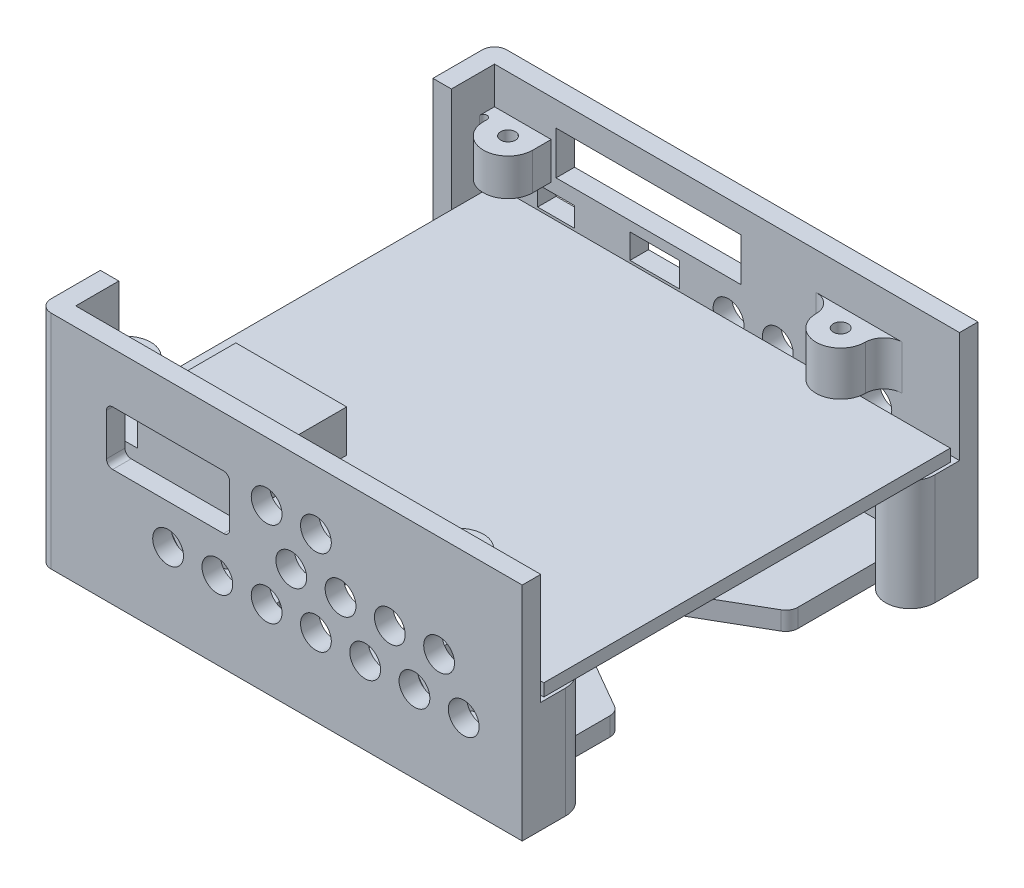
from build123d import *

# Parameters (mm, degrees)
SKETCH1_W                           = 38
SKETCH1_H                           = 33
BOSS_EXTRUDE1_DEPTH                 = 1.5
BOSS_EXTRUDE2_DEPTH                 = 7.5
BOSS_EXTRUDE2_DEPTH_BACK            = 1.5
SKETCH2_R                           = 2
F_1_2_1_2_DIAMETER_HOLE1_D          = 1.2
SKETCH5_W                           = 37
SKETCH5_H                           = 33
BOSS_EXTRUDE3_DEPTH                 = 1
SKETCH6_W                           = 9
SKETCH6_H                           = 8
BOSS_EXTRUDE4_DEPTH                 = 3.4
SKETCH7_W                           = 38
SKETCH7_H                           = 1.5
BOSS_EXTRUDE5_DEPTH                 = 15
BOSS_EXTRUDE6_DEPTH                 = 3
CUT_EXTRUDE1_START                  = -1
CUT_EXTRUDE1_DEPTH                  = 1
SKETCH12_W                          = 38
SKETCH12_H                          = 2
BOSS_EXTRUDE7_DEPTH                 = 1.5
FILLET1_R                           = 1.5
SKETCH11_W                          = 0.6
SKETCH11_H                          = 6
F_1_2_1_2_DIAMETER_HOLE2_AT_2_COUNT = 2
F_1_2_1_2_DIAMETER_HOLE2_AT_2_PITCH = 27
F_1_2_1_2_DIAMETER_HOLE2_AT_3_COUNT = 2
F_1_2_1_2_DIAMETER_HOLE2_AT_3_PITCH = 41.109609582
F_1_2_1_2_DIAMETER_HOLE2_AT_4_COUNT = 2
F_1_2_1_2_DIAMETER_HOLE2_AT_4_PITCH = 31
CUT_EXTRUDE2_START                  = 13
CUT_EXTRUDE2_DEPTH                  = 1
CUT_EXTRUDE2_START_2                = -5
CUT_EXTRUDE2_2_DEPTH                = 5
SKETCH14_W                          = 15
SKETCH14_H                          = 12.618354367
CUT_EXTRUDE3_DEPTH                  = 2.5
SKETCH15_W                          = 4
SKETCH15_H                          = 2
SKETCH15_W_2                        = 3
SKETCH15_H_2                        = 1.6
CUT_EXTRUDE4_DEPTH                  = 1.5
SKETCH20_W                          = 38
SKETCH20_H                          = 1.5
BOSS_EXTRUDE10_DEPTH                = 3
FILL_START                          = -18.5
FILL_PATTERN1_OUTLINE_R             = 1.25
FILL_PATTERN1_DEPTH                 = 1.5
FILL_START_2                        = 17
FILL_PATTERN2_OUTLINE_R             = 1.25
FILL_PATTERN2_DEPTH                 = 1.5
SKETCH16_R                          = 1.05
CUT_EXTRUDE5_DEPTH                  = 1.5
BOSS_EXTRUDE8_DEPTH                 = 1.6
CUT_EXTRUDE6_DEPTH                  = 1.6
SKETCH21_W                          = 15
SKETCH21_H                          = 1.5
CUT_EXTRUDE7_DEPTH                  = 1
SKETCH24_W                          = 1.5
SKETCH24_H                          = 5
BOSS_EXTRUDE11_DEPTH                = 18
SKETCH26_W                          = 4
SKETCH26_H                          = 24
CUT_EXTRUDE9_DEPTH                  = 7
CUT_EXTRUDE10_DEPTH                 = 0.25
CUT_EXTRUDE11_START                 = -7
CUT_EXTRUDE11_DEPTH                 = 7
SKETCH29_R                          = 0.6
CUT_EXTRUDE12_DEPTH                 = 7
FILLET2_START                       = 13
FILLET2_DEPTH                       = 2
FILLET2_START_2                     = 12
FILLET2_2_DEPTH                     = 3
SKETCH30_R                          = 0.6
BOSS_EXTRUDE13_DEPTH                = 0.6
FILLET3_START                       = 1.5
FILLET3_DEPTH                       = 17.5
FILLET3_START_2                     = -1
FILLET3_2_DEPTH                     = 2.651008
FILLET3_3_DEPTH                     = 1.5
FILLET3_START_3                     = 1.34157
FILLET3_4_DEPTH                     = 1.75843


with BuildPart() as part:
    # Sketch1 → Boss-Extrude1 (new body)
    with BuildSketch(Plane(origin=(0, 0, 0), x_dir=(1, 0, 0), z_dir=(0, 1, 0))):
        Rectangle(SKETCH1_W, SKETCH1_H)
    extrude(amount=BOSS_EXTRUDE1_DEPTH)

    # Sketch2 → Boss-Extrude2 (add, two sides: drawn at the far end of the back side and taken through both)
    with BuildSketch(Plane(origin=(0, 1.5, 0), x_dir=(1, 0, 0), z_dir=(0, 1, 0)).offset(-BOSS_EXTRUDE2_DEPTH_BACK)):
        with Locations(Location((-16.75, 9.75, 0), (0, 0, 270))):
            Circle(SKETCH2_R)
        with Locations(Location((-16.75, -9.75, 0), (0, 0, 270))):
            Circle(SKETCH2_R)
        with BuildLine():
            Line((16.75, 17), (18.75, 17))
            Line((18.75, 17), (18.75, 15))
            ThreePointArc((18.75, 15), (15.335786438, 13.585786438), (16.75, 17))
        make_face()
        with BuildLine():
            Line((16.75, -17), (18.75, -17))
            Line((18.75, -17), (18.75, -15))
            ThreePointArc((18.75, -15), (15.335786438, -13.585786438), (16.75, -17))
        make_face()
    extrude(amount=BOSS_EXTRUDE2_DEPTH + BOSS_EXTRUDE2_DEPTH_BACK)

    # Ø1.2 (1.2) Diameter Hole1 (through all)
    with Locations(Plane(origin=(0, 9, 0), x_dir=(1, 0, 0), z_dir=(0, 1, 0))):
        with Locations((-16.75, 9.75), (-16.75, -9.75), (16.75, -15), (16.75, 15)):
            Hole(F_1_2_1_2_DIAMETER_HOLE1_D / 2)

    # Sketch7 → Boss-Extrude5 (add)
    with BuildSketch(Plane(origin=(0, 0, 0), x_dir=(1, 0, 0), z_dir=(0, 1, 0))):
        with Locations((0, 17.75)):
            Rectangle(SKETCH7_W, SKETCH7_H)
        with Locations((0, -17.75)):
            Rectangle(SKETCH7_W, SKETCH7_H)
    extrude(amount=BOSS_EXTRUDE5_DEPTH)

    # Sketch8 → Boss-Extrude6 (add)
    with BuildSketch(Plane(origin=(0, 15, 0), x_dir=(1, 0, 0), z_dir=(0, 1, 0))):
        with BuildLine():
            Line((12.6, 15.5), (12.6, 18.5))
            Line((12.6, 18.5), (8.6, 18.5))
            Line((8.6, 18.5), (8.6, 15.5))
            ThreePointArc((8.6, 15.5), (10.6, 13.5), (12.6, 15.5))
        make_face()
        with BuildLine():
            Line((-18.4, 15.5), (-18.4, 18.5))
            Line((-18.4, 18.5), (-14.4, 18.5))
            Line((-14.4, 18.5), (-14.4, 15.5))
            ThreePointArc((-14.4, 15.5), (-16.4, 13.5), (-18.4, 15.5))
        make_face()
        with BuildLine():
            Line((-18.4, -15.5), (-18.4, -18.5))
            Line((-18.4, -18.5), (-14.4, -18.5))
            Line((-14.4, -18.5), (-14.4, -15.5))
            ThreePointArc((-14.4, -15.5), (-16.4, -13.5), (-18.4, -15.5))
        make_face()
        with BuildLine():
            Line((8.6, -15.5), (8.6, -18.5))
            Line((8.6, -18.5), (12.6, -18.5))
            Line((12.6, -18.5), (12.6, -15.5))
            ThreePointArc((12.6, -15.5), (10.6, -13.5), (8.6, -15.5))
        make_face()
    extrude(amount=-BOSS_EXTRUDE6_DEPTH)

    # Sketch9 → Cut-Extrude1 (cut)
    with BuildSketch(Plane.XZ.offset(-12).offset(CUT_EXTRUDE1_START)):
        with BuildLine():
            Line((-14.4, 15.5), (-14.4, 17))
            Line((-14.4, 17), (-18.4, 17))
            Line((-18.4, 17), (-18.4, 15.5))
            ThreePointArc((-18.4, 15.5), (-16.4, 13.5), (-14.4, 15.5))
        make_face()
    extrude(amount=CUT_EXTRUDE1_DEPTH, mode=Mode.SUBTRACT)

    # Sketch12 → Boss-Extrude7 (add)
    with BuildSketch(Plane.XZ):
        with Locations((0, -17.5)):
            Rectangle(SKETCH12_W, SKETCH12_H)
        with Locations((0, 17.5)):
            Rectangle(SKETCH12_W, SKETCH12_H)
    extrude(amount=-BOSS_EXTRUDE7_DEPTH)

    # Fillet1
    # the kernel refuses this fillet: 1.5 mm, written as the material it adds along each edge
    with BuildSketch(Plane(origin=(12.6, 12, 17), x_dir=(1, 0, 0), z_dir=(0, 1, 0)), Plane(origin=(8.6, 15, 17), x_dir=(-1, 0, 0), z_dir=(0, -1, 0))) as fillet1_piece_1:
        with BuildLine():
            CenterArc((FILLET1_R, FILLET1_R), FILLET1_R, 180, 90)
            Line((0, FILLET1_R), (-FILLET1_R * 0.02, FILLET1_R))
            Line((-FILLET1_R * 0.02, FILLET1_R), (-FILLET1_R * 0.02, -FILLET1_R * 0.02))
            Line((-FILLET1_R * 0.02, -FILLET1_R * 0.02), (FILLET1_R, -FILLET1_R * 0.02))
            Line((FILLET1_R, -FILLET1_R * 0.02), (FILLET1_R, 0))
        make_face()
    extrude(amount=3)
    with BuildSketch(Plane(origin=(8.6, 15, -17), x_dir=(-1, 0, 0), z_dir=(0, -1, 0)), Plane(origin=(12.6, 12, -17), x_dir=(1, 0, 0), z_dir=(0, 1, 0))) as fillet1_piece_2:
        with BuildLine():
            CenterArc((FILLET1_R, -FILLET1_R), FILLET1_R, 90, 90)
            Line((0, -FILLET1_R), (-FILLET1_R * 0.02, -FILLET1_R))
            Line((-FILLET1_R * 0.02, -FILLET1_R), (-FILLET1_R * 0.02, FILLET1_R * 0.02))
            Line((-FILLET1_R * 0.02, FILLET1_R * 0.02), (FILLET1_R, FILLET1_R * 0.02))
            Line((FILLET1_R, FILLET1_R * 0.02), (FILLET1_R, 0))
        make_face()
    extrude(amount=3)
    with BuildSketch(Plane(origin=(-18.4, 12, -17), x_dir=(-1, 0, 0), z_dir=(0, 1, 0))) as fillet1_piece_3:
        with BuildLine():
            CenterArc((1.5, 1.2), FILLET1_R, 180, 53.130102354)
            Line((0, 1.2), (-0.03, 1.2))
            Line((-0.03, 1.2), (-0.03, 0))
            Line((-0.03, 0), (0, -0.03))
            ThreePointArc((0, -0.03), (0.3, -0.03), (0.582, -0.024))
            Line((0.582, -0.024), (0.6, 0))
        make_face()
    extrude(amount=3)
    with BuildSketch(Plane(origin=(-14.4, 13, 17), x_dir=(1, 0, 0), z_dir=(0, 1, 0))) as fillet1_piece_4:
        with BuildLine():
            CenterArc((FILLET1_R, FILLET1_R), FILLET1_R, 180, 90)
            Line((0, FILLET1_R), (-FILLET1_R * 0.02, FILLET1_R))
            Line((-FILLET1_R * 0.02, FILLET1_R), (-FILLET1_R * 0.02, -FILLET1_R * 0.02))
            Line((-FILLET1_R * 0.02, -FILLET1_R * 0.02), (FILLET1_R, -FILLET1_R * 0.02))
            Line((FILLET1_R, -FILLET1_R * 0.02), (FILLET1_R, 0))
        make_face()
    extrude(amount=2)
    with BuildSketch(Plane(origin=(-18.4, 15, 17), x_dir=(-1, 0, 0), z_dir=(0, -1, 0))) as fillet1_piece_5:
        with BuildLine():
            CenterArc((1.5, 1.2), FILLET1_R, 180, 53.130102354)
            Line((0, 1.2), (-0.03, 1.2))
            Line((-0.03, 1.2), (-0.03, 0))
            Line((-0.03, 0), (0, -0.03))
            ThreePointArc((0, -0.03), (0.3, -0.03), (0.582, -0.024))
            Line((0.582, -0.024), (0.6, 0))
        make_face()
    extrude(amount=2)

    # Sketch11 → Ø1.2 (1.2) Diameter Hole2 (revolve, cut)
    with BuildSketch(Plane(origin=(-16.4, 15, 15.5), x_dir=(0, 0, 1), z_dir=(1, 0, 0))):
        with Locations((0.3, 3)):
            Rectangle(SKETCH11_W, SKETCH11_H)
    f_1_2_1_2_diameter_hole2 = revolve(axis=Axis((-16.4, 21.35, 15.5), (0, -1, 0)), mode=Mode.SUBTRACT)

    # Ø1.2 (1.2) Diameter Hole2 at 2: Ø1.2 (1.2) Diameter Hole2 ×2
    with Locations(*[(i * F_1_2_1_2_DIAMETER_HOLE2_AT_2_PITCH, 0, 0) for i in range(1, F_1_2_1_2_DIAMETER_HOLE2_AT_2_COUNT)]):
        add(f_1_2_1_2_diameter_hole2, mode=Mode.SUBTRACT)

    # Ø1.2 (1.2) Diameter Hole2 at 3: Ø1.2 (1.2) Diameter Hole2 ×2
    with Locations(*[Vector(0.6567807448042019, 0, -0.7540815958863059) * (i * F_1_2_1_2_DIAMETER_HOLE2_AT_3_PITCH) for i in range(1, F_1_2_1_2_DIAMETER_HOLE2_AT_3_COUNT)]):
        add(f_1_2_1_2_diameter_hole2, mode=Mode.SUBTRACT)

    # Ø1.2 (1.2) Diameter Hole2 at 4: Ø1.2 (1.2) Diameter Hole2 ×2
    with Locations(*[(0, 0, -i * F_1_2_1_2_DIAMETER_HOLE2_AT_4_PITCH) for i in range(1, F_1_2_1_2_DIAMETER_HOLE2_AT_4_COUNT)]):
        add(f_1_2_1_2_diameter_hole2, mode=Mode.SUBTRACT)

    # Cut-Extrude2 2 outline → Cut-Extrude2 2 (cut)
    with BuildSketch(Plane.XY.offset(18.5).offset(CUT_EXTRUDE2_START_2)):
        with BuildLine():
            ThreePointArc((-5, 13.4), (-5.146446609, 13.753553391), (-5.5, 13.9))
            Line((-5.5, 13.9), (-14.5, 13.9))
            ThreePointArc((-14.5, 13.9), (-14.853553391, 13.753553391), (-15, 13.4))
            Line((-15, 13.4), (-15, 13))
            Line((-15, 13), (-15, 10))
            ThreePointArc((-15, 10), (-14.853553391, 9.646446609), (-14.5, 9.5))
            Line((-14.5, 9.5), (-5.5, 9.5))
            ThreePointArc((-5.5, 9.5), (-5.146446609, 9.646446609), (-5, 10))
            Line((-5, 10), (-5, 13.4))
        make_face()
    extrude(amount=CUT_EXTRUDE2_2_DEPTH, mode=Mode.SUBTRACT)

    # Sketch14 → Cut-Extrude3 (cut)
    with BuildSketch(Plane(origin=(0, 15, 0), x_dir=(1, 0, 0), z_dir=(0, 1, 0))):
        with Locations((-6.5, 16.147378524)):
            Rectangle(SKETCH14_W, SKETCH14_H)
    extrude(amount=-CUT_EXTRUDE3_DEPTH, mode=Mode.SUBTRACT)

    # Sketch15 → Cut-Extrude4 (cut)
    with BuildSketch(Plane(origin=(0, 0, -18.5), x_dir=(-1, 0, 0), z_dir=(0, 0, -1))):
        with Locations((6, 10.7)):
            Rectangle(SKETCH15_W, SKETCH15_H)
        with Locations((14, 10.5)):
            Rectangle(SKETCH15_W_2, SKETCH15_H_2)
    extrude(amount=-CUT_EXTRUDE4_DEPTH, mode=Mode.SUBTRACT)

    # Sketch20 → Boss-Extrude10 (add)
    with BuildSketch(Plane(origin=(0, 15, 0), x_dir=(1, 0, 0), z_dir=(0, 1, 0))):
        with Locations((0, -17.75)):
            Rectangle(SKETCH20_W, SKETCH20_H)
        with Locations((0, 17.75)):
            Rectangle(SKETCH20_W, SKETCH20_H)
    extrude(amount=BOSS_EXTRUDE10_DEPTH)

    # Fill Pattern1: read off the stored shape, not the designer's step
    # Fill Pattern1 outline → Fill Pattern1 (cut)
    with BuildSketch(Plane.XY.offset(FILL_START)):
        with Locations((14, 6.285898385)):
            Circle(FILL_PATTERN1_OUTLINE_R)
        with Locations((-2, 6.285898385)):
            Circle(FILL_PATTERN1_OUTLINE_R)
        with Locations((2, 6.285898385)):
            Circle(FILL_PATTERN1_OUTLINE_R)
        with Locations((6, 6.285898385)):
            Circle(FILL_PATTERN1_OUTLINE_R)
        with Locations((-6, 6.285898385)):
            Circle(FILL_PATTERN1_OUTLINE_R)
        with Locations((-10, 6.285898385)):
            Circle(FILL_PATTERN1_OUTLINE_R)
        with Locations((-14, 6.285898385)):
            Circle(FILL_PATTERN1_OUTLINE_R)
        with Locations((10, 6.285898385)):
            Circle(FILL_PATTERN1_OUTLINE_R)
        with Locations((0, 9.75)):
            Circle(FILL_PATTERN1_OUTLINE_R)
        with Locations((4, 9.75)):
            Circle(FILL_PATTERN1_OUTLINE_R)
        with Locations((8, 9.75)):
            Circle(FILL_PATTERN1_OUTLINE_R)
        with Locations((12, 9.75)):
            Circle(FILL_PATTERN1_OUTLINE_R)
    extrude(amount=FILL_PATTERN1_DEPTH, mode=Mode.SUBTRACT)

    # Fill Pattern2: read off the stored shape, not the designer's step
    # Fill Pattern2 outline → Fill Pattern2 (cut)
    with BuildSketch(Plane.XY.offset(FILL_START_2)):
        with Locations((14, 6.285898385)):
            Circle(FILL_PATTERN2_OUTLINE_R)
        with Locations((-2, 6.285898385)):
            Circle(FILL_PATTERN2_OUTLINE_R)
        with Locations((2, 6.285898385)):
            Circle(FILL_PATTERN2_OUTLINE_R)
        with Locations((6, 6.285898385)):
            Circle(FILL_PATTERN2_OUTLINE_R)
        with Locations((-6, 6.285898385)):
            Circle(FILL_PATTERN2_OUTLINE_R)
        with Locations((-10, 6.285898385)):
            Circle(FILL_PATTERN2_OUTLINE_R)
        with Locations((10, 6.285898385)):
            Circle(FILL_PATTERN2_OUTLINE_R)
        with Locations((0, 9.75)):
            Circle(FILL_PATTERN2_OUTLINE_R)
        with Locations((4, 9.75)):
            Circle(FILL_PATTERN2_OUTLINE_R)
        with Locations((8, 9.75)):
            Circle(FILL_PATTERN2_OUTLINE_R)
        with Locations((12, 9.75)):
            Circle(FILL_PATTERN2_OUTLINE_R)
        with Locations((2, 13.214101615)):
            Circle(FILL_PATTERN2_OUTLINE_R)
        with Locations((-2, 13.214101615)):
            Circle(FILL_PATTERN2_OUTLINE_R)
    extrude(amount=FILL_PATTERN2_DEPTH, mode=Mode.SUBTRACT)

    # Sketch16 → Cut-Extrude5 (cut)
    with BuildSketch(Plane.XZ):
        with Locations(Location((7, 10, 0), (0, 0, 270))):
            Circle(SKETCH16_R)
        with Locations(Location((7, -10, 0), (0, 0, 270))):
            Circle(SKETCH16_R)
        with Locations(Location((-13, -10, 0), (0, 0, 270))):
            Circle(SKETCH16_R)
        with Locations(Location((-13, 10, 0), (0, 0, 270))):
            Circle(SKETCH16_R)
    extrude(amount=-CUT_EXTRUDE5_DEPTH, mode=Mode.SUBTRACT)

    # Sketch17 → Boss-Extrude8 (add)
    # profile 1 of 4: a face of its own
    with BuildSketch(Plane(origin=(0, 1.5, 0), x_dir=(1, 0, 0), z_dir=(0, 1, 0))):
        Polygon((10.55, 7.950406544), (10.55, 12.049593456), (7, 14.099186911), (3.45, 12.049593456), (3.45, 7.950406544), (7, 5.900813089), align=None)
        Polygon((9.05, 8.816431948), (9.05, 11.183568052), (7, 12.367136104), (4.95, 11.183568052), (4.95, 8.816431948), (7, 7.632863896), align=None, mode=Mode.SUBTRACT)
    # profile 2 of 4: a face of its own
    with BuildSketch(Plane(origin=(0, 1.5, 0), x_dir=(1, 0, 0), z_dir=(0, 1, 0))):
        Polygon((10.55, -7.950406544), (7, -5.900813089), (3.45, -7.950406544), (3.45, -12.049593456), (7, -14.099186911), (10.55, -12.049593456), align=None)
        Polygon((9.05, -8.816431948), (7, -7.632863896), (4.95, -8.816431948), (4.95, -11.183568052), (7, -12.367136104), (9.05, -11.183568052), align=None, mode=Mode.SUBTRACT)
    # profile 3 of 4: a face of its own
    with BuildSketch(Plane(origin=(0, 1.5, 0), x_dir=(1, 0, 0), z_dir=(0, 1, 0))):
        Polygon((-9.45, -7.950406544), (-13, -5.900813089), (-16.55, -7.950406544), (-16.55, -12.049593456), (-13, -14.099186911), (-9.45, -12.049593456), align=None)
        Polygon((-10.95, -8.816431948), (-13, -7.632863896), (-15.05, -8.816431948), (-15.05, -11.183568052), (-13, -12.367136104), (-10.95, -11.183568052), align=None, mode=Mode.SUBTRACT)
    # profile 4 of 4: a face of its own
    with BuildSketch(Plane(origin=(0, 1.5, 0), x_dir=(1, 0, 0), z_dir=(0, 1, 0))):
        Polygon((-13, 5.900813089), (-9.45, 7.950406544), (-9.45, 12.049593456), (-13, 14.099186911), (-16.55, 12.049593456), (-16.55, 7.950406544), align=None)
        Polygon((-13, 7.632863896), (-10.95, 8.816431948), (-10.95, 11.183568052), (-13, 12.367136104), (-15.05, 11.183568052), (-15.05, 8.816431948), align=None, mode=Mode.SUBTRACT)
    extrude(amount=BOSS_EXTRUDE8_DEPTH)

    # Sketch18 → Cut-Extrude6 (cut)
    with BuildSketch(Plane(origin=(0, 1.5, 0), x_dir=(1, 0, 0), z_dir=(0, 1, 0))):
        Polygon((0.45, -6.218355737), (7, -2.436711474), (15, -7.055513627), (15, 7.055513627), (7, 2.436711474), (0.45, 6.218355737), (0.45, 14), (-6.45, 14), (-6.45, 6.218355737), (-13, 2.436711474), (-17.5, 5.034787685), (-17.5, -5.034787685), (-13, -2.436711474), (-6.45, -6.218355737), (-6.45, -14), (0.45, -14), align=None)
    extrude(amount=-CUT_EXTRUDE6_DEPTH, mode=Mode.SUBTRACT)

    # Sketch21 → Cut-Extrude7 (cut)
    with BuildSketch(Plane.XZ.offset(-15)):
        with Locations((-6.5, -17.75)):
            Rectangle(SKETCH21_W, SKETCH21_H)
    extrude(amount=-CUT_EXTRUDE7_DEPTH, mode=Mode.SUBTRACT)

    # Sketch24 → Boss-Extrude11 (add)
    with BuildSketch(Plane.XZ):
        with Locations((-19.75, -16)):
            Rectangle(SKETCH24_W, SKETCH24_H)
        with Locations((-19.75, 16)):
            Rectangle(SKETCH24_W, SKETCH24_H)
    extrude(amount=-BOSS_EXTRUDE11_DEPTH)

    # Sketch26 → Cut-Extrude9 (cut)
    with BuildSketch(Plane(origin=(0, 1.5, 0), x_dir=(1, 0, 0), z_dir=(0, 1, 0))):
        with Locations((17, 0)):
            Rectangle(SKETCH26_W, SKETCH26_H)
    extrude(amount=-CUT_EXTRUDE9_DEPTH, mode=Mode.SUBTRACT)

    # Sketch27 → Cut-Extrude10 (cut)
    with BuildSketch(Plane(origin=(19, 0, 0), x_dir=(0, 0, -1), z_dir=(1, 0, 0))):
        Polygon((-12, 0), (-12, 1.5), (-17, 1.5), (-17, 18), (-18.5, 18), (-18.5, 0), align=None)
        Polygon((12, 1.5), (12, 0), (18.5, 0), (18.5, 18), (17, 18), (17, 1.5), align=None)
    extrude(amount=-CUT_EXTRUDE10_DEPTH, mode=Mode.SUBTRACT)

    # Sketch28 → Cut-Extrude11 (cut)
    with BuildSketch(Plane(origin=(0, 1.5, 0), x_dir=(1, 0, 0), z_dir=(0, 1, 0)).offset(CUT_EXTRUDE11_START)):
        with BuildLine():
            Line((18.75, -15), (18.75, -12))
            Line((18.75, -12), (15, -12))
            Line((15, -12), (15, -14.031754163))
            ThreePointArc((15, -14.031754163), (17.25, -13.063508327), (18.75, -15))
        make_face()
        with BuildLine():
            Line((18.75, 15), (18.75, 12))
            Line((18.75, 12), (15, 12))
            Line((15, 12), (15, 14.031754163))
            ThreePointArc((15, 14.031754163), (17.25, 13.063508327), (18.75, 15))
        make_face()
    extrude(amount=CUT_EXTRUDE11_DEPTH, mode=Mode.SUBTRACT)

    # Sketch29 → Cut-Extrude12 (cut)
    with BuildSketch(Plane(origin=(0, 1.5, 0), x_dir=(1, 0, 0), z_dir=(0, 1, 0))):
        with Locations(Location((-16.75, -9.75, 0), (0, 0, 270))):
            Circle(SKETCH29_R)
        with Locations(Location((-16.75, 9.75, 0), (0, 0, 270))):
            Circle(SKETCH29_R)
        Polygon((-15.05, -11.183568052), (-15.05, -8.816431948), (-13, -7.632863896), (-10.95, -8.816431948), (-10.95, -11.183568052), (-13, -12.367136104), align=None)
        Polygon((-15.05, 11.183568052), (-15.05, 8.816431948), (-14.997569049, 8.786160925), (-13, 7.632863896), (-10.95, 8.816431948), (-10.95, 11.183568052), (-13, 12.367136104), align=None)
    extrude(amount=CUT_EXTRUDE12_DEPTH, mode=Mode.SUBTRACT)

    # Fillet2: read off the stored shape, not the designer's step
    # Fillet2 outline → Fillet2 (add)
    with BuildSketch(Plane(origin=(0, 0, 0), x_dir=(1, 0, 0), z_dir=(0, 1, 0)).offset(FILLET2_START)):
        with BuildLine():
            ThreePointArc((-18.4, -15.8), (-18.7, -16.1), (-19, -15.8))
            Line((-19, -15.8), (-19, -17))
            ThreePointArc((-19, -17), (-18.558359214, -16.470820393), (-18.4, -15.8))
        make_face()
        with BuildLine():
            Line((-19, 17), (-19, 15.8))
            ThreePointArc((-19, 15.8), (-18.7, 16.1), (-18.4, 15.8))
            ThreePointArc((-18.4, 15.8), (-18.558359214, 16.470820393), (-19, 17))
        make_face()
    extrude(amount=FILLET2_DEPTH)

    # Fillet2 2 outline → Fillet2 2 (add)
    with BuildSketch(Plane(origin=(0, 0, 0), x_dir=(1, 0, 0), z_dir=(0, 1, 0)).offset(FILLET2_START_2)):
        with BuildLine():
            Line((-19, 17), (-19, 15.8))
            ThreePointArc((-19, 15.8), (-18.7, 16.1), (-18.4, 15.8))
            ThreePointArc((-18.4, 15.8), (-18.558359214, 16.470820393), (-19, 17))
        make_face()
    extrude(amount=FILLET2_2_DEPTH)

    # Sketch30 → Boss-Extrude13 (add)
    with BuildSketch(Plane.XZ.offset(-12)):
        with BuildLine():
            Line((7.1, -17), (14.1, -17))
            ThreePointArc((14.1, -17), (13.039339828, -16.560660172), (12.6, -15.5))
            ThreePointArc((12.6, -15.5), (10.6, -13.5), (8.6, -15.5))
            ThreePointArc((8.6, -15.5), (8.160660172, -16.560660172), (7.1, -17))
        make_face()
        with Locations(Location((10.6, -15.5, 0), (0, 0, 90))):
            Circle(SKETCH30_R, mode=Mode.SUBTRACT)
    extrude(amount=BOSS_EXTRUDE13_DEPTH)

    # Fillet3: read off the stored shape, not the designer's step
    # Fillet3 outline → Fillet3 (cut)
    with BuildSketch(Plane(origin=(0, 0, 0), x_dir=(1, 0, 0), z_dir=(0, 1, 0)).offset(FILLET3_START)):
        with BuildLine():
            ThreePointArc((-19.5, -18.5), (-20.207106781, -18.207106781), (-20.5, -17.5))
            Line((-20.5, -17.5), (-20.5, -18.5))
            Line((-20.5, -18.5), (-19.5, -18.5))
        make_face()
        with BuildLine():
            ThreePointArc((-20.5, 17.5), (-20.207106781, 18.207106781), (-19.5, 18.5))
            Line((-19.5, 18.5), (-20.5, 18.5))
            Line((-20.5, 18.5), (-20.5, 17.5))
        make_face()
        with BuildLine():
            Line((-13, -5.900813089), (-13.5, -6.189488223))
            ThreePointArc((-13.5, -6.189488223), (-13, -6.055513627), (-12.5, -6.189488223))
            Line((-12.5, -6.189488223), (-13, -5.900813089))
        make_face()
        with BuildLine():
            ThreePointArc((-12.5, -13.810511777), (-13, -13.944486373), (-13.5, -13.810511777))
            Line((-13.5, -13.810511777), (-13, -14.099186911))
            Line((-13, -14.099186911), (-12.5, -13.810511777))
        make_face()
        with BuildLine():
            Line((-9.45, -7.950406544), (-9.95, -7.66173141))
            ThreePointArc((-9.95, -7.66173141), (-9.583974596, -8.027756814), (-9.45, -8.527756814))
            Line((-9.45, -8.527756814), (-9.45, -7.950406544))
        make_face()
        with BuildLine():
            ThreePointArc((-9.45, -11.472243186), (-9.583974596, -11.972243186), (-9.95, -12.33826859))
            Line((-9.95, -12.33826859), (-9.45, -12.049593456))
            Line((-9.45, -12.049593456), (-9.45, -11.472243186))
        make_face()
        with BuildLine():
            Line((-9.45, 12.049593456), (-9.95, 12.33826859))
            ThreePointArc((-9.95, 12.33826859), (-9.583974596, 11.972243186), (-9.45, 11.472243186))
            Line((-9.45, 11.472243186), (-9.45, 12.049593456))
        make_face()
        with BuildLine():
            ThreePointArc((-13.5, 13.810511777), (-13, 13.944486373), (-12.5, 13.810511777))
            Line((-12.5, 13.810511777), (-13, 14.099186911))
            Line((-13, 14.099186911), (-13.5, 13.810511777))
        make_face()
        with BuildLine():
            Line((-9.45, 7.950406544), (-9.45, 8.527756814))
            ThreePointArc((-9.45, 8.527756814), (-9.583974596, 8.027756814), (-9.95, 7.66173141))
            Line((-9.95, 7.66173141), (-9.45, 7.950406544))
        make_face()
        with BuildLine():
            Line((-13, 5.900813089), (-12.5, 6.189488223))
            ThreePointArc((-12.5, 6.189488223), (-13, 6.055513627), (-13.5, 6.189488223))
            Line((-13.5, 6.189488223), (-13, 5.900813089))
        make_face()
        with BuildLine():
            Line((10.55, -12.049593456), (10.55, -11.472243186))
            ThreePointArc((10.55, -11.472243186), (10.416025404, -11.972243186), (10.05, -12.33826859))
            Line((10.05, -12.33826859), (10.55, -12.049593456))
        make_face()
        with BuildLine():
            ThreePointArc((10.05, -7.66173141), (10.416025404, -8.027756814), (10.55, -8.527756814))
            Line((10.55, -8.527756814), (10.55, -7.950406544))
            Line((10.55, -7.950406544), (10.05, -7.66173141))
        make_face()
        with BuildLine():
            Line((7, -14.099186911), (7.5, -13.810511777))
            ThreePointArc((7.5, -13.810511777), (7, -13.944486373), (6.5, -13.810511777))
            Line((6.5, -13.810511777), (7, -14.099186911))
        make_face()
        with BuildLine():
            ThreePointArc((6.5, -6.189488223), (7, -6.055513627), (7.5, -6.189488223))
            Line((7.5, -6.189488223), (7, -5.900813089))
            Line((7, -5.900813089), (6.5, -6.189488223))
        make_face()
        with BuildLine():
            Line((3.45, -12.049593456), (3.95, -12.33826859))
            ThreePointArc((3.95, -12.33826859), (3.583974596, -11.972243186), (3.45, -11.472243186))
            Line((3.45, -11.472243186), (3.45, -12.049593456))
        make_face()
        with BuildLine():
            ThreePointArc((3.45, -8.527756814), (3.583974596, -8.027756814), (3.95, -7.66173141))
            Line((3.95, -7.66173141), (3.45, -7.950406544))
            Line((3.45, -7.950406544), (3.45, -8.527756814))
        make_face()
        with BuildLine():
            Line((7, 5.900813089), (7.5, 6.189488223))
            ThreePointArc((7.5, 6.189488223), (7, 6.055513627), (6.5, 6.189488223))
            Line((6.5, 6.189488223), (7, 5.900813089))
        make_face()
        with BuildLine():
            ThreePointArc((10.55, 8.527756814), (10.416025404, 8.027756814), (10.05, 7.66173141))
            Line((10.05, 7.66173141), (10.55, 7.950406544))
            Line((10.55, 7.950406544), (10.55, 8.527756814))
        make_face()
        with BuildLine():
            Line((3.45, 7.950406544), (3.95, 7.66173141))
            ThreePointArc((3.95, 7.66173141), (3.583974596, 8.027756814), (3.45, 8.527756814))
            Line((3.45, 8.527756814), (3.45, 7.950406544))
        make_face()
        with BuildLine():
            ThreePointArc((10.05, 12.33826859), (10.416025404, 11.972243186), (10.55, 11.472243186))
            Line((10.55, 11.472243186), (10.55, 12.049593456))
            Line((10.55, 12.049593456), (10.05, 12.33826859))
        make_face()
        with BuildLine():
            Line((3.45, 12.049593456), (3.45, 11.472243186))
            ThreePointArc((3.45, 11.472243186), (3.583974596, 11.972243186), (3.95, 12.33826859))
            Line((3.95, 12.33826859), (3.45, 12.049593456))
        make_face()
        with BuildLine():
            ThreePointArc((6.5, 13.810511777), (7, 13.944486373), (7.5, 13.810511777))
            Line((7.5, 13.810511777), (7, 14.099186911))
            Line((7, 14.099186911), (6.5, 13.810511777))
        make_face()
    extrude(amount=FILLET3_DEPTH, mode=Mode.SUBTRACT)

    # Fillet3 2 outline → Fillet3 2 (cut)
    with BuildSketch(Plane(origin=(0, 0, 0), x_dir=(1, 0, 0), z_dir=(0, 1, 0)).offset(FILLET3_START_2)):
        with BuildLine():
            ThreePointArc((-19.5, -18.5), (-20.207106781, -18.207106781), (-20.5, -17.5))
            Line((-20.5, -17.5), (-20.5, -18.5))
            Line((-20.5, -18.5), (-19.5, -18.5))
        make_face()
        with BuildLine():
            ThreePointArc((-20.5, 17.5), (-20.207106781, 18.207106781), (-19.5, 18.5))
            Line((-19.5, 18.5), (-20.5, 18.5))
            Line((-20.5, 18.5), (-20.5, 17.5))
        make_face()
        with BuildLine():
            Line((15, -7.055513627), (14.5, -6.766838493))
            ThreePointArc((14.5, -6.766838493), (14.866025404, -7.132863896), (15, -7.632863896))
            Line((15, -7.632863896), (15, -7.055513627))
        make_face()
        with BuildLine():
            Line((7, -2.436711474), (6.5, -2.725386608))
            ThreePointArc((6.5, -2.725386608), (7, -2.591412012), (7.5, -2.725386608))
            Line((7.5, -2.725386608), (7, -2.436711474))
        make_face()
        with BuildLine():
            Line((0.45, -6.218355737), (0.45, -6.795706006))
            ThreePointArc((0.45, -6.795706006), (0.583974596, -6.295706006), (0.95, -5.929680602))
            Line((0.95, -5.929680602), (0.45, -6.218355737))
        make_face()
        with BuildLine():
            Line((-6.45, -6.218355737), (-6.95, -5.929680602))
            ThreePointArc((-6.95, -5.929680602), (-6.583974596, -6.295706006), (-6.45, -6.795706006))
            Line((-6.45, -6.795706006), (-6.45, -6.218355737))
        make_face()
        with BuildLine():
            Line((-13, -2.436711474), (-13.5, -2.725386608))
            ThreePointArc((-13.5, -2.725386608), (-13, -2.591412012), (-12.5, -2.725386608))
            Line((-12.5, -2.725386608), (-13, -2.436711474))
        make_face()
        with BuildLine():
            Line((-13, 2.436711474), (-12.5, 2.725386608))
            ThreePointArc((-12.5, 2.725386608), (-13, 2.591412012), (-13.5, 2.725386608))
            Line((-13.5, 2.725386608), (-13, 2.436711474))
        make_face()
        with BuildLine():
            Line((-6.45, 6.218355737), (-6.45, 6.795706006))
            ThreePointArc((-6.45, 6.795706006), (-6.583974596, 6.295706006), (-6.95, 5.929680602))
            Line((-6.95, 5.929680602), (-6.45, 6.218355737))
        make_face()
        with BuildLine():
            Line((0.45, 6.218355737), (0.95, 5.929680602))
            ThreePointArc((0.95, 5.929680602), (0.583974596, 6.295706006), (0.45, 6.795706006))
            Line((0.45, 6.795706006), (0.45, 6.218355737))
        make_face()
        with BuildLine():
            Line((7, 2.436711474), (7.5, 2.725386608))
            ThreePointArc((7.5, 2.725386608), (7, 2.591412012), (6.5, 2.725386608))
            Line((6.5, 2.725386608), (7, 2.436711474))
        make_face()
        with BuildLine():
            ThreePointArc((15, 7.632863896), (14.866025404, 7.132863896), (14.5, 6.766838493))
            Line((14.5, 6.766838493), (15, 7.055513627))
            Line((15, 7.055513627), (15, 7.632863896))
        make_face()
    extrude(amount=FILLET3_2_DEPTH, mode=Mode.SUBTRACT)

    # Fillet3 3 outline → Fillet3 3 (add)
    with BuildSketch(Plane(origin=(0, 0, 0), x_dir=(1, 0, 0), z_dir=(0, 1, 0))):
        with BuildLine():
            ThreePointArc((0.45, -13), (0.157106781, -13.707106781), (-0.55, -14))
            Line((-0.55, -14), (0.45, -14))
            Line((0.45, -14), (0.45, -13))
        make_face()
        with BuildLine():
            ThreePointArc((-5.45, -14), (-6.157106781, -13.707106781), (-6.45, -13))
            Line((-6.45, -13), (-6.45, -14))
            Line((-6.45, -14), (-5.45, -14))
        make_face()
        with BuildLine():
            ThreePointArc((-16, -4.168762281), (-17, -4.168762281), (-17.5, -3.302736877))
            Line((-17.5, -3.302736877), (-17.5, -5.034787685))
            Line((-17.5, -5.034787685), (-16, -4.168762281))
        make_face()
        with BuildLine():
            ThreePointArc((-17.5, 3.302736877), (-17, 4.168762281), (-16, 4.168762281))
            Line((-16, 4.168762281), (-17.5, 5.034787685))
            Line((-17.5, 5.034787685), (-17.5, 3.302736877))
        make_face()
        with BuildLine():
            ThreePointArc((-6.45, 13), (-6.157106781, 13.707106781), (-5.45, 14))
            Line((-5.45, 14), (-6.45, 14))
            Line((-6.45, 14), (-6.45, 13))
        make_face()
        with BuildLine():
            ThreePointArc((-0.55, 14), (0.157106781, 13.707106781), (0.45, 13))
            Line((0.45, 13), (0.45, 14))
            Line((0.45, 14), (-0.55, 14))
        make_face()
    extrude(amount=FILLET3_3_DEPTH)

    # Fillet3 4 outline → Fillet3 4 (add)
    with BuildSketch(Plane(origin=(0, 0, 0), x_dir=(1, 0, 0), z_dir=(0, 1, 0)).offset(FILLET3_START_3)):
        with BuildLine():
            ThreePointArc((-15.990335567, -7.627284133), (-16.273601506, -7.737489413), (-16.576890378, -7.75750582))
            ThreePointArc((-16.576890378, -7.75750582), (-16.434680893, -7.775012947), (-16.294089786, -7.802656713))
            Line((-16.294089786, -7.802656713), (-15.990335567, -7.627284133))
        make_face()
        with BuildLine():
            ThreePointArc((-16.55, -11.739974874), (-16.838347292, -11.748047736), (-17.124856754, -11.714556544))
            ThreePointArc((-17.124856754, -11.714556544), (-16.808746284, -11.832862229), (-16.55, -12.049593456))
            Line((-16.55, -12.049593456), (-16.55, -11.739974874))
        make_face()
        with BuildLine():
            Line((-16.55, 11.739974874), (-16.55, 12.049593456))
            ThreePointArc((-16.55, 12.049593456), (-16.808746284, 11.832862229), (-17.124856754, 11.714556544))
            ThreePointArc((-17.124856754, 11.714556544), (-16.838347292, 11.748047736), (-16.55, 11.739974874))
        make_face()
        with BuildLine():
            ThreePointArc((-16.294089786, 7.802656713), (-16.434680893, 7.775012947), (-16.576890378, 7.75750582))
            ThreePointArc((-16.576890378, 7.75750582), (-16.273601506, 7.737489413), (-15.990335567, 7.627284133))
            Line((-15.990335567, 7.627284133), (-16.294089786, 7.802656713))
        make_face()
    extrude(amount=FILLET3_4_DEPTH)


with BuildPart() as body_2:
    # Sketch5 → Boss-Extrude3 (new body)
    with BuildSketch(Plane(origin=(0, 9, 0), x_dir=(1, 0, 0), z_dir=(0, 1, 0))):
        Rectangle(SKETCH5_W, SKETCH5_H)
    extrude(amount=BOSS_EXTRUDE3_DEPTH)

    # Sketch6 → Boss-Extrude4 (add)
    with BuildSketch(Plane(origin=(0, 10, 0), x_dir=(1, 0, 0), z_dir=(0, 1, 0))):
        with Locations((-10, -12.5)):
            Rectangle(SKETCH6_W, SKETCH6_H)
    extrude(amount=BOSS_EXTRUDE4_DEPTH)

    # Cut-Extrude2: read off the stored shape, not the designer's step
    # Cut-Extrude2 outline → Cut-Extrude2 (cut)
    with BuildSketch(Plane(origin=(0, 0, 0), x_dir=(1, 0, 0), z_dir=(0, 1, 0)).offset(CUT_EXTRUDE2_START)):
        with BuildLine():
            ThreePointArc((-14.018033989, -16.5), (-14.301258538, -16.035233134), (-14.4, -15.5))
            ThreePointArc((-14.4, -15.5), (-14.425158234, -15.183772234), (-14.5, -14.8755002))
            Line((-14.5, -14.8755002), (-14.5, -16.5))
            Line((-14.5, -16.5), (-14.018033989, -16.5))
        make_face()
    extrude(amount=CUT_EXTRUDE2_DEPTH, mode=Mode.SUBTRACT)


solid = Compound([part.part, body_2.part])
